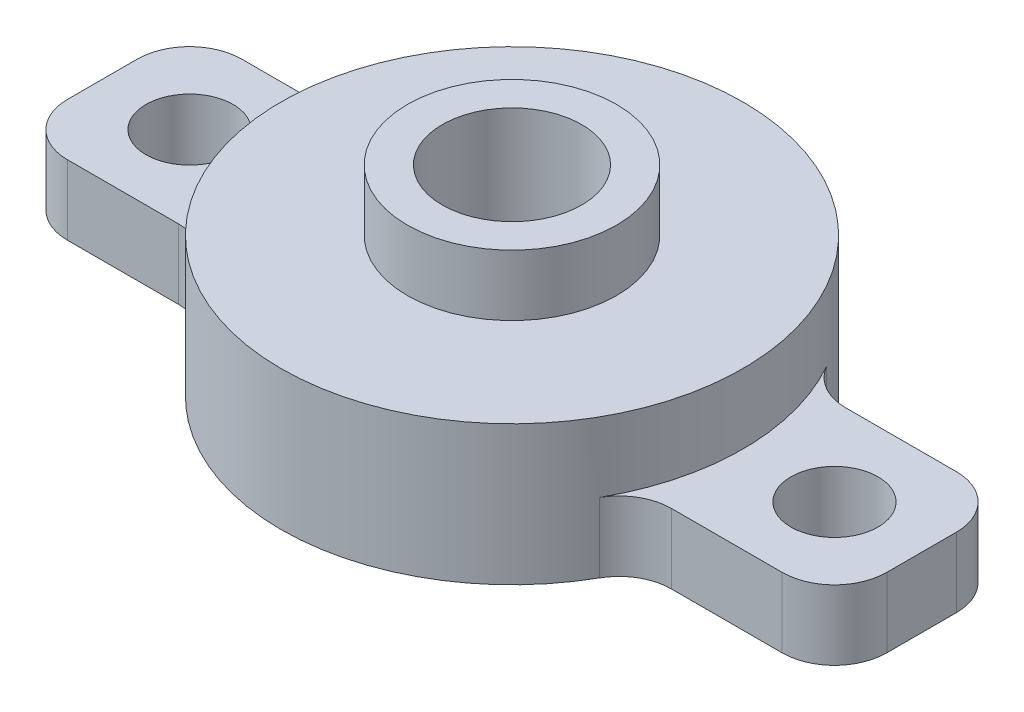
from build123d import *
from build123d.topology import SkipClean

# Parameters (mm, degrees)
EXTRUDE_1_DEPTH     = 4
SKETCH_2_R          = 13.25
EXTRUDE_2_DEPTH     = 4
SKETCH_3_R          = 6
EXTRUDE_3_DEPTH     = 3.5
CUT_EXTRUDE_1_REACH = 31.327
SKETCH_4_R          = 4
FILLET_1_R          = 3
HOLE_WIZARD_1_D     = 5


with BuildPart() as part:
    # 草图1 → 凸台-拉伸1 (new body)
    with BuildSketch(Plane(origin=(0, 0, 0), x_dir=(1, 0, 0), z_dir=(0, 1, 0))):
        with BuildLine():
            Line((-3, 5), (-12.270391192, 5))
            ThreePointArc((-12.270391192, 5), (-13.25, 0), (-12.270391192, -5))
            Line((-12.270391192, -5), (-3, -5))
            Line((-3, -5), (-3, 5))
        make_face()
        with BuildLine():
            Line((-12.270391192, 5), (-23.5, 5))
            Line((-23.5, 5), (-23.5, -5))
            Line((-23.5, -5), (-12.270391192, -5))
            ThreePointArc((-12.270391192, -5), (-13.25, 0), (-12.270391192, 5))
        make_face()
        with BuildLine():
            ThreePointArc((12.270391192, 5), (0, 13.25), (-12.270391192, 5))
            Line((-12.270391192, 5), (-3, 5))
            Line((-3, 5), (-3, -5))
            Line((-3, -5), (-12.270391192, -5))
            ThreePointArc((-12.270391192, -5), (0, -13.25), (12.270391192, -5))
            Line((12.270391192, -5), (3, -5))
            Line((3, -5), (3, 5))
            Line((3, 5), (12.270391192, 5))
        make_face()
        with BuildLine():
            ThreePointArc((13.25, 0), (13.002791687, 2.547529853), (12.270391192, 5))
            Line((12.270391192, 5), (3, 5))
            Line((3, 5), (3, -5))
            Line((3, -5), (12.270391192, -5))
            ThreePointArc((12.270391192, -5), (13.002791687, -2.547529853), (13.25, 0))
        make_face()
        with BuildLine():
            Line((23.5, 5), (12.270391192, 5))
            ThreePointArc((12.270391192, 5), (13.002791687, 2.547529853), (13.25, 0))
            ThreePointArc((13.25, 0), (13.002791687, -2.547529853), (12.270391192, -5))
            Line((12.270391192, -5), (23.5, -5))
            Line((23.5, -5), (23.5, 5))
        make_face()
    extrude(amount=EXTRUDE_1_DEPTH)

    # 草图2 → 凸台-拉伸2 (add)
    with BuildSketch(Plane(origin=(0, 4, 0), x_dir=(1, 0, 0), z_dir=(0, 1, 0))):
        with Locations(Location((0, 0, 0), (0, 0, 22.170157164))):
            Circle(SKETCH_2_R)
    extrude(amount=EXTRUDE_2_DEPTH)

    # 草图3 → 凸台-拉伸3 (add)
    with SkipClean():  # the faces are left unmerged after this step: merging them gives an invalid solid
        with BuildSketch(Plane(origin=(0, 8, 0), x_dir=(1, 0, 0), z_dir=(0, 1, 0))):
            with Locations(Location((0, 0, 0), (0, 0, 270))):
                Circle(SKETCH_3_R)
        extrude(amount=EXTRUDE_3_DEPTH)

    # 草图4 → 切除-拉伸1 (cut, up to next)
    with BuildSketch(Plane(origin=(0, 11.5, 0), x_dir=(1, 0, 0), z_dir=(0, 1, 0)), mode=Mode.PRIVATE) as cut_extrude_1_sk1:
        with Locations(Location((0, 0, 0), (0, 0, 270))):
            Circle(SKETCH_4_R)
    cut_extrude_1_tool1 = extrude(cut_extrude_1_sk1.sketch, amount=-CUT_EXTRUDE_1_REACH, mode=Mode.PRIVATE) & part.part
    add(cut_extrude_1_tool1.solids().sort_by_distance((0, 11.5, 0))[0], mode=Mode.SUBTRACT)

    # 圆角1
    # the kernel refuses this fillet: 3 mm, written as the material it adds along each edge
    with BuildSketch(Plane(origin=(-12.270391192, 0, 5), x_dir=(-1, 0, 0), z_dir=(0, 1, 0))) as fillet_1_piece_1:
        with BuildLine():
            CenterArc((1.873953968, 3), FILLET_1_R, 209.492372675, 60.507627325)
            ThreePointArc((-0.737309754, 1.523076923), (-0.344316056, 0.773320696), (0, 0))
            Line((0, 0), (1.873953968, 0))
        make_face()
    extrude(amount=4)
    with BuildSketch(Plane(origin=(-12.270391192, 0, -5), x_dir=(0.43572231670003575, 0, -0.9000811423030447), z_dir=(0, 1, 0)), Plane(origin=(12.270391192, 0, 5), x_dir=(-0.4357223167001389, 0, 0.9000811423029949), z_dir=(0, 1, 0))) as fillet_1_piece_2:
        with BuildLine():
            CenterArc((1.883719863, 2.993877578), FILLET_1_R, 205.831264919, 60.507627325)
            Line((-0.816523564, 1.686710628), (0, 0))
            ThreePointArc((0, 0), (0.846077565, 0.027040696), (1.692155131, 0))
        make_face()
    extrude(amount=4)
    with BuildSketch(Plane(origin=(12.270391192, 0, -5), x_dir=(-0.43572231670013994, 0, -0.9000811423029943), z_dir=(0, 1, 0))) as fillet_1_piece_3:
        with BuildLine():
            CenterArc((1.883719863, -2.993877578), FILLET_1_R, 93.661107756, 60.507627325)
            Line((-0.816523564, -1.686710628), (0, 0))
            ThreePointArc((0, 0), (0.846077565, -0.027040696), (1.692155131, 0))
        make_face()
    extrude(amount=4)
    # the kernel refuses this fillet: 3 mm, written as the material it takes off along each edge
    with BuildSketch(Plane(origin=(-23.5, -7.5, 5), x_dir=(1, 0, 0), z_dir=(0, 1, 0)), Plane(origin=(23.5, -7.5, -5), x_dir=(-1, 0, 0), z_dir=(0, 1, 0)), Plane(origin=(23.5, -7.5, 5), x_dir=(0, 0, -1), z_dir=(0, 1, 0))) as fillet_1_2_piece_1:
        with BuildLine():
            CenterArc((FILLET_1_R, FILLET_1_R), FILLET_1_R, 180, 90)
            Line((0, FILLET_1_R), (0, 0))
            Line((0, 0), (FILLET_1_R, 0))
        make_face()
    extrude(amount=19, mode=Mode.SUBTRACT)
    with BuildSketch(Plane(origin=(-23.5, -7.5, -5), x_dir=(1, 0, 0), z_dir=(0, 1, 0))) as fillet_1_2_piece_2:
        with BuildLine():
            CenterArc((FILLET_1_R, -FILLET_1_R), FILLET_1_R, 90, 90)
            Line((0, -FILLET_1_R), (0, 0))
            Line((0, 0), (FILLET_1_R, 0))
        make_face()
    extrude(amount=19, mode=Mode.SUBTRACT)

    # 孔1 (through all)
    with Locations(Plane(origin=(0, 4, 0), x_dir=(1, 0, 0), z_dir=(0, 1, 0))):
        with Locations((-18.5, 0), (18.5, 0)):
            Hole(HOLE_WIZARD_1_D / 2)


solid = part.part
